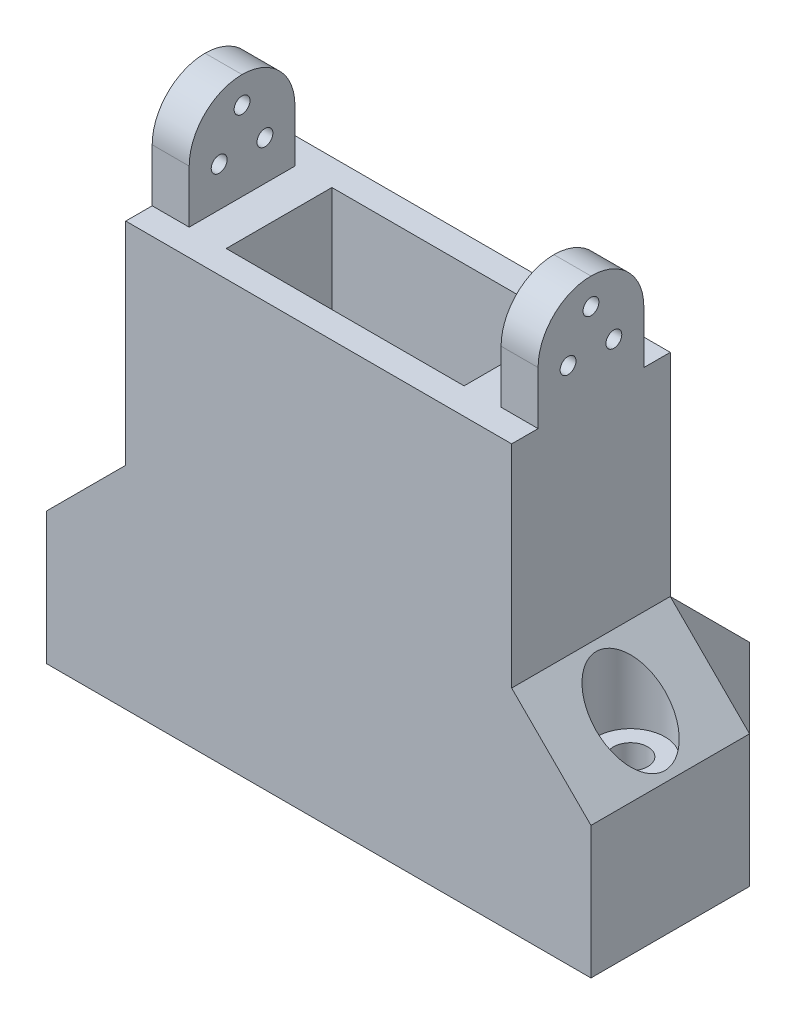
from build123d import *

# Parameters (mm, degrees)
BOSS_EXTRUDE1_DEPTH = 30
SKETCH2_R           = 3.25
SKETCH2_W           = 45
SKETCH2_H           = 20
CUT_EXTRUDE1_DEPTH  = 90
SKETCH3_W           = 7
SKETCH3_H           = 20
BOSS_EXTRUDE2_DEPTH = 20
SKETCH4_R           = 1.5
CUT_EXTRUDE2_DEPTH  = 80
FILLET1_R           = 10
CUT_EXTRUDE3_START  = -25
SKETCH5_R           = 6.5
CUT_EXTRUDE3_DEPTH  = 17
BOSS_EXTRUDE3_DEPTH = 73
SKETCH7_R           = 3.25
CUT_EXTRUDE4_DEPTH  = 40
CUT_EXTRUDE5_START  = -25
SKETCH8_R           = 6.5
CUT_EXTRUDE5_DEPTH  = 17


with BuildPart() as part:
    # Sketch1 → Boss-Extrude1 (new body)
    with BuildSketch(Plane.XY):
        Polygon((0, 40), (-15, 25), (-15, 0), (0, 0), (73, 0), (88, 0), (88, 25), (73, 40), (73, 80), (0, 80), align=None)
    extrude(amount=BOSS_EXTRUDE1_DEPTH)

    # Sketch2 → Cut-Extrude1 (cut)
    with BuildSketch(Plane.XZ):
        with Locations(Location((-7.5, 15, 0), (0, 0, 270))):
            Circle(SKETCH2_R)
        with Locations(Location((80.5, 15, 0), (0, 0, 270))):
            Circle(SKETCH2_R)
        with Locations((36.5, 15)):
            Rectangle(SKETCH2_W, SKETCH2_H)
    extrude(amount=-CUT_EXTRUDE1_DEPTH, mode=Mode.SUBTRACT)

    # Sketch3 → Boss-Extrude2 (add)
    with BuildSketch(Plane(origin=(0, 80, 0), x_dir=(1, 0, 0), z_dir=(0, 1, 0))):
        with Locations((3.5, -15)):
            Rectangle(SKETCH3_W, SKETCH3_H)
        with Locations((69.5, -15)):
            Rectangle(SKETCH3_W, SKETCH3_H)
    extrude(amount=BOSS_EXTRUDE2_DEPTH)

    # Sketch4 → Cut-Extrude2 (cut)
    with BuildSketch(Plane(origin=(73, 0, 0), x_dir=(0, 0, -1), z_dir=(1, 0, 0))):
        with Locations((-15, 95)):
            Circle(SKETCH4_R)
        with Locations((-10.669872981, 87.5)):
            Circle(SKETCH4_R)
        with Locations((-19.330127019, 87.5)):
            Circle(SKETCH4_R)
    extrude(amount=-CUT_EXTRUDE2_DEPTH, mode=Mode.SUBTRACT)

    # Fillet1
    fillet1_edges = [part.edges().sort_by_distance(p)[0] for p in [
        (3.5, 100, 25),
        (69.5, 100, 25),
        (3.5, 100, 5),
        (69.5, 100, 5),
    ]]
    fillet(fillet1_edges, radius=FILLET1_R - 0.0001)  # a hair under: the kernel refuses the full size

    # Sketch5 → Cut-Extrude3 (cut)
    with BuildSketch(Plane.XZ.offset(CUT_EXTRUDE3_START)):
        with Locations(Location((-7.5, 15, 0), (0, 0, 270))):
            Circle(SKETCH5_R)
        with Locations(Location((80.5, 15, 0), (0, 0, 270))):
            Circle(SKETCH5_R)
    extrude(amount=-CUT_EXTRUDE3_DEPTH, mode=Mode.SUBTRACT)

    # Sketch6 → Boss-Extrude3 (add)
    with BuildSketch(Plane(origin=(0, 0, 0), x_dir=(0, 0, -1), z_dir=(1, 0, 0))):
        Polygon((0, 40), (0, 0), (15, 0), (15, 25), align=None)
    extrude(amount=BOSS_EXTRUDE3_DEPTH)

    # Sketch7 → Cut-Extrude4 (cut)
    with BuildSketch(Plane.XZ):
        with Locations(Location((36.5, -7.5, 0), (0, 0, 270))):
            Circle(SKETCH7_R)
    extrude(amount=-CUT_EXTRUDE4_DEPTH, mode=Mode.SUBTRACT)

    # Sketch8 → Cut-Extrude5 (cut)
    with BuildSketch(Plane.XZ.offset(CUT_EXTRUDE5_START)):
        with Locations(Location((36.5, -7.5, 0), (0, 0, 270))):
            Circle(SKETCH8_R)
    extrude(amount=-CUT_EXTRUDE5_DEPTH, mode=Mode.SUBTRACT)


solid = part.part
